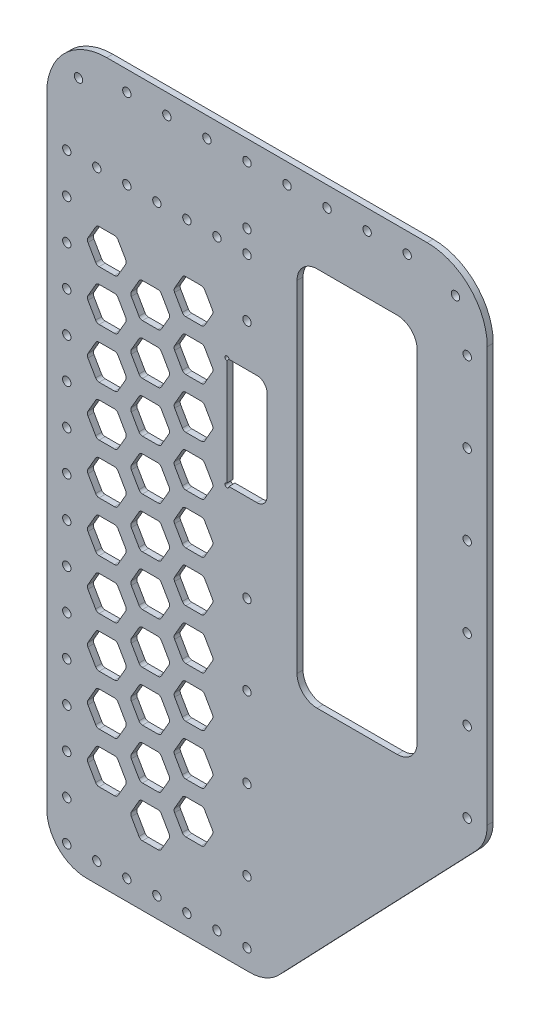
from build123d import *

# Parameters (mm, degrees)
SKETCH1_W           = 110
SKETCH1_H           = 320
BOSS_EXTRUDE1_DEPTH = 3
BOSS_EXTRUDE2_DEPTH = 3
SKETCH3_W           = 20
SKETCH3_H           = 55
SKETCH3_W_2         = 60
SKETCH3_H_2         = 190
CUT_EXTRUDE1_DEPTH  = 260.295198567
CUT_EXTRUDE2_DEPTH  = 260.295198567
FILLET1_R           = 2
FILL_PATTERN2_DEPTH = 3
SKETCH6_R           = 2.1
CUT_EXTRUDE3_DEPTH  = 260.295198567
SKETCH8_R           = 1
CUT_EXTRUDE4_DEPTH  = 260.295198567
FILLET2_R           = 5
FILLET3_R           = 10
FILLET4_R           = 20
SKETCH9_R           = 2.1
CUT_EXTRUDE5_DEPTH  = 260.295198567
SKETCH10_R          = 2.1
CUT_EXTRUDE6_DEPTH  = 260.295198567
SKETCH11_R          = 2.1
CUT_EXTRUDE7_DEPTH  = 260.295198567


# Read off the part's stored shape, not the designer's step: Fill Pattern2
with BuildPart() as part:
    # Sketch1 → Boss-Extrude1 (new body)
    with BuildSketch(Plane.XY):
        Rectangle(SKETCH1_W, SKETCH1_H)
    extrude(amount=BOSS_EXTRUDE1_DEPTH)

    # Sketch2 → Boss-Extrude2 (add)
    with BuildSketch(Plane.XY.offset(3)):
        with BuildLine():
            Line((-55, 160), (-55, 170))
            ThreePointArc((-55, 170), (-46.213203436, 191.213203436), (-25, 200))
            Line((-25, 200), (135, 200))
            ThreePointArc((135, 200), (156.213203436, 191.213203436), (165, 170))
            Line((165, 170), (165, -45))
            Line((165, -45), (55, -160))
            Line((55, -160), (55, 160))
            Line((55, 160), (-55, 160))
        make_face()
    extrude(amount=-BOSS_EXTRUDE2_DEPTH)

    # Sketch3 → Cut-Extrude1 (cut, through all)
    with BuildSketch(Plane.XY.offset(3)):
        with Locations((45, 72.508427125)):
            Rectangle(SKETCH3_W, SKETCH3_H)
        with Locations((100, 66.131519895)):
            Rectangle(SKETCH3_W_2, SKETCH3_H_2)
    extrude(amount=-CUT_EXTRUDE1_DEPTH, mode=Mode.SUBTRACT)

    # Sketch5 → Cut-Extrude2 (cut, through all)
    with BuildSketch(Plane.XY.offset(3)):
        Polygon((-20, 125), (-30, 125), (-35, 116.339745962), (-30, 107.679491924), (-20, 107.679491924), (-15, 116.339745962), align=None)
    extrude(amount=-CUT_EXTRUDE2_DEPTH, mode=Mode.SUBTRACT)

    # Fillet1
    fillet1_edges = [part.edges().sort_by_distance(p)[0] for p in [
        (-20, 125, 1.5),
        (-15, 116.339745962, 1.5),
        (-20, 107.679491924, 1.5),
        (-30, 107.679491924, 1.5),
        (-35, 116.339745962, 1.5),
        (-30, 125, 1.5),
    ]]
    fillet(fillet1_edges, radius=FILLET1_R)

    # Fill Pattern2 outline → Fill Pattern2 (cut)
    with BuildSketch(Plane.XY):
        with BuildLine():
            ThreePointArc((6.073284825, 77.839745962), (6.341234018, 78.839745962), (6.073284825, 79.839745962))
            Line((6.073284825, 79.839745962), (2.227985364, 86.5))
            ThreePointArc((2.227985364, 86.5), (1.495934556, 87.232050808), (0.495934556, 87.5))
            Line((0.495934556, 87.5), (-7.194664367, 87.5))
            ThreePointArc((-7.194664367, 87.5), (-8.194664367, 87.232050808), (-8.926715175, 86.5))
            Line((-8.926715175, 86.5), (-12.772014636, 79.839745962))
            ThreePointArc((-12.772014636, 79.839745962), (-13.039963829, 78.839745962), (-12.772014636, 77.839745962))
            Line((-12.772014636, 77.839745962), (-8.926715175, 71.179491924))
            ThreePointArc((-8.926715175, 71.179491924), (-8.194664367, 70.447441117), (-7.194664367, 70.179491924))
            Line((-7.194664367, 70.179491924), (0.495934556, 70.179491924))
            ThreePointArc((0.495934556, 70.179491924), (1.495934556, 70.447441117), (2.227985364, 71.179491924))
            Line((2.227985364, 71.179491924), (6.073284825, 77.839745962))
        make_face()
        with BuildLine():
            ThreePointArc((27.72391992, 40.339745962), (27.991869112, 41.339745962), (27.72391992, 42.339745962))
            Line((27.72391992, 42.339745962), (23.878620458, 49))
            ThreePointArc((23.878620458, 49), (23.146569651, 49.732050808), (22.146569651, 50))
            Line((22.146569651, 50), (14.455970728, 50))
            ThreePointArc((14.455970728, 50), (13.455970728, 49.732050808), (12.72391992, 49))
            Line((12.72391992, 49), (8.878620458, 42.339745962))
            ThreePointArc((8.878620458, 42.339745962), (8.610671266, 41.339745962), (8.878620458, 40.339745962))
            Line((8.878620458, 40.339745962), (12.72391992, 33.679491924))
            ThreePointArc((12.72391992, 33.679491924), (13.455970728, 32.947441117), (14.455970728, 32.679491924))
            Line((14.455970728, 32.679491924), (22.146569651, 32.679491924))
            ThreePointArc((22.146569651, 32.679491924), (23.146569651, 32.947441117), (23.878620458, 33.679491924))
            Line((23.878620458, 33.679491924), (27.72391992, 40.339745962))
        make_face()
        with BuildLine():
            ThreePointArc((12.72391992, 108.679491924), (13.455970728, 107.947441117), (14.455970728, 107.679491924))
            Line((14.455970728, 107.679491924), (22.146569651, 107.679491924))
            ThreePointArc((22.146569651, 107.679491924), (23.146569651, 107.947441117), (23.878620458, 108.679491924))
            Line((23.878620458, 108.679491924), (27.72391992, 115.339745962))
            ThreePointArc((27.72391992, 115.339745962), (27.991869112, 116.339745962), (27.72391992, 117.339745962))
            Line((27.72391992, 117.339745962), (23.878620458, 124))
            ThreePointArc((23.878620458, 124), (23.146569651, 124.732050808), (22.146569651, 125))
            Line((22.146569651, 125), (14.455970728, 125))
            ThreePointArc((14.455970728, 125), (13.455970728, 124.732050808), (12.72391992, 124))
            Line((12.72391992, 124), (8.878620458, 117.339745962))
            ThreePointArc((8.878620458, 117.339745962), (8.610671266, 116.339745962), (8.878620458, 115.339745962))
            Line((8.878620458, 115.339745962), (12.72391992, 108.679491924))
        make_face()
        with BuildLine():
            ThreePointArc((-21.154700538, 32.679491924), (-20.154700538, 32.947441117), (-19.422649731, 33.679491924))
            Line((-19.422649731, 33.679491924), (-15.577350269, 40.339745962))
            ThreePointArc((-15.577350269, 40.339745962), (-15.309401077, 41.339745962), (-15.577350269, 42.339745962))
            Line((-15.577350269, 42.339745962), (-19.422649731, 49))
            ThreePointArc((-19.422649731, 49), (-20.154700538, 49.732050808), (-21.154700538, 50))
            Line((-21.154700538, 50), (-28.845299462, 50))
            ThreePointArc((-28.845299462, 50), (-29.845299462, 49.732050808), (-30.577350269, 49))
            Line((-30.577350269, 49), (-34.422649731, 42.339745962))
            ThreePointArc((-34.422649731, 42.339745962), (-34.690598923, 41.339745962), (-34.422649731, 40.339745962))
            Line((-34.422649731, 40.339745962), (-30.577350269, 33.679491924))
            ThreePointArc((-30.577350269, 33.679491924), (-29.845299462, 32.947441117), (-28.845299462, 32.679491924))
            Line((-28.845299462, 32.679491924), (-21.154700538, 32.679491924))
        make_face()
        with BuildLine():
            ThreePointArc((27.72391992, -59.660254038), (27.991869112, -58.660254038), (27.72391992, -57.660254038))
            Line((27.72391992, -57.660254038), (23.878620458, -51))
            ThreePointArc((23.878620458, -51), (23.146569651, -50.267949192), (22.146569651, -50))
            Line((22.146569651, -50), (14.455970728, -50))
            ThreePointArc((14.455970728, -50), (13.455970728, -50.267949192), (12.72391992, -51))
            Line((12.72391992, -51), (8.878620458, -57.660254038))
            ThreePointArc((8.878620458, -57.660254038), (8.610671266, -58.660254038), (8.878620458, -59.660254038))
            Line((8.878620458, -59.660254038), (12.72391992, -66.320508076))
            ThreePointArc((12.72391992, -66.320508076), (13.455970728, -67.052558883), (14.455970728, -67.320508076))
            Line((14.455970728, -67.320508076), (22.146569651, -67.320508076))
            ThreePointArc((22.146569651, -67.320508076), (23.146569651, -67.052558883), (23.878620458, -66.320508076))
            Line((23.878620458, -66.320508076), (27.72391992, -59.660254038))
        make_face()
        with BuildLine():
            ThreePointArc((6.073284825, -22.160254038), (6.341234018, -21.160254038), (6.073284825, -20.160254038))
            Line((6.073284825, -20.160254038), (2.227985364, -13.5))
            ThreePointArc((2.227985364, -13.5), (1.495934556, -12.767949192), (0.495934556, -12.5))
            Line((0.495934556, -12.5), (-7.194664367, -12.5))
            ThreePointArc((-7.194664367, -12.5), (-8.194664367, -12.767949192), (-8.926715175, -13.5))
            Line((-8.926715175, -13.5), (-12.772014636, -20.160254038))
            ThreePointArc((-12.772014636, -20.160254038), (-13.039963829, -21.160254038), (-12.772014636, -22.160254038))
            Line((-12.772014636, -22.160254038), (-8.926715175, -28.820508076))
            ThreePointArc((-8.926715175, -28.820508076), (-8.194664367, -29.552558883), (-7.194664367, -29.820508076))
            Line((-7.194664367, -29.820508076), (0.495934556, -29.820508076))
            ThreePointArc((0.495934556, -29.820508076), (1.495934556, -29.552558883), (2.227985364, -28.820508076))
            Line((2.227985364, -28.820508076), (6.073284825, -22.160254038))
        make_face()
        with BuildLine():
            ThreePointArc((-15.577350269, 15.339745962), (-15.309401077, 16.339745962), (-15.577350269, 17.339745962))
            Line((-15.577350269, 17.339745962), (-19.422649731, 24))
            ThreePointArc((-19.422649731, 24), (-20.154700538, 24.732050808), (-21.154700538, 25))
            Line((-21.154700538, 25), (-28.845299462, 25))
            ThreePointArc((-28.845299462, 25), (-29.845299462, 24.732050808), (-30.577350269, 24))
            Line((-30.577350269, 24), (-34.422649731, 17.339745962))
            ThreePointArc((-34.422649731, 17.339745962), (-34.690598923, 16.339745962), (-34.422649731, 15.339745962))
            Line((-34.422649731, 15.339745962), (-30.577350269, 8.679491924))
            ThreePointArc((-30.577350269, 8.679491924), (-29.845299462, 7.947441117), (-28.845299462, 7.679491924))
            Line((-28.845299462, 7.679491924), (-21.154700538, 7.679491924))
            ThreePointArc((-21.154700538, 7.679491924), (-20.154700538, 7.947441117), (-19.422649731, 8.679491924))
            Line((-19.422649731, 8.679491924), (-15.577350269, 15.339745962))
        make_face()
        with BuildLine():
            ThreePointArc((0.495934556, -104.820508076), (1.495934556, -104.552558883), (2.227985364, -103.820508076))
            Line((2.227985364, -103.820508076), (6.073284825, -97.160254038))
            ThreePointArc((6.073284825, -97.160254038), (6.341234018, -96.160254038), (6.073284825, -95.160254038))
            Line((6.073284825, -95.160254038), (2.227985364, -88.5))
            ThreePointArc((2.227985364, -88.5), (1.495934556, -87.767949192), (0.495934556, -87.5))
            Line((0.495934556, -87.5), (-7.194664367, -87.5))
            ThreePointArc((-7.194664367, -87.5), (-8.194664367, -87.767949192), (-8.926715175, -88.5))
            Line((-8.926715175, -88.5), (-12.772014636, -95.160254038))
            ThreePointArc((-12.772014636, -95.160254038), (-13.039963829, -96.160254038), (-12.772014636, -97.160254038))
            Line((-12.772014636, -97.160254038), (-8.926715175, -103.820508076))
            ThreePointArc((-8.926715175, -103.820508076), (-8.194664367, -104.552558883), (-7.194664367, -104.820508076))
            Line((-7.194664367, -104.820508076), (0.495934556, -104.820508076))
        make_face()
        with BuildLine():
            ThreePointArc((-30.577350269, -66.320508076), (-29.845299462, -67.052558883), (-28.845299462, -67.320508076))
            Line((-28.845299462, -67.320508076), (-21.154700538, -67.320508076))
            ThreePointArc((-21.154700538, -67.320508076), (-20.154700538, -67.052558883), (-19.422649731, -66.320508076))
            Line((-19.422649731, -66.320508076), (-15.577350269, -59.660254038))
            ThreePointArc((-15.577350269, -59.660254038), (-15.309401077, -58.660254038), (-15.577350269, -57.660254038))
            Line((-15.577350269, -57.660254038), (-19.422649731, -51))
            ThreePointArc((-19.422649731, -51), (-20.154700538, -50.267949192), (-21.154700538, -50))
            Line((-21.154700538, -50), (-28.845299462, -50))
            ThreePointArc((-28.845299462, -50), (-29.845299462, -50.267949192), (-30.577350269, -51))
            Line((-30.577350269, -51), (-34.422649731, -57.660254038))
            ThreePointArc((-34.422649731, -57.660254038), (-34.690598923, -58.660254038), (-34.422649731, -59.660254038))
            Line((-34.422649731, -59.660254038), (-30.577350269, -66.320508076))
        make_face()
        with BuildLine():
            ThreePointArc((6.073284825, -72.160254038), (6.341234018, -71.160254038), (6.073284825, -70.160254038))
            Line((6.073284825, -70.160254038), (2.227985364, -63.5))
            ThreePointArc((2.227985364, -63.5), (1.495934556, -62.767949192), (0.495934556, -62.5))
            Line((0.495934556, -62.5), (-7.194664367, -62.5))
            ThreePointArc((-7.194664367, -62.5), (-8.194664367, -62.767949192), (-8.926715175, -63.5))
            Line((-8.926715175, -63.5), (-12.772014636, -70.160254038))
            ThreePointArc((-12.772014636, -70.160254038), (-13.039963829, -71.160254038), (-12.772014636, -72.160254038))
            Line((-12.772014636, -72.160254038), (-8.926715175, -78.820508076))
            ThreePointArc((-8.926715175, -78.820508076), (-8.194664367, -79.552558883), (-7.194664367, -79.820508076))
            Line((-7.194664367, -79.820508076), (0.495934556, -79.820508076))
            ThreePointArc((0.495934556, -79.820508076), (1.495934556, -79.552558883), (2.227985364, -78.820508076))
            Line((2.227985364, -78.820508076), (6.073284825, -72.160254038))
        make_face()
        with BuildLine():
            ThreePointArc((-15.577350269, -34.660254038), (-15.309401077, -33.660254038), (-15.577350269, -32.660254038))
            Line((-15.577350269, -32.660254038), (-19.422649731, -26))
            ThreePointArc((-19.422649731, -26), (-20.154700538, -25.267949192), (-21.154700538, -25))
            Line((-21.154700538, -25), (-28.845299462, -25))
            ThreePointArc((-28.845299462, -25), (-29.845299462, -25.267949192), (-30.577350269, -26))
            Line((-30.577350269, -26), (-34.422649731, -32.660254038))
            ThreePointArc((-34.422649731, -32.660254038), (-34.690598923, -33.660254038), (-34.422649731, -34.660254038))
            Line((-34.422649731, -34.660254038), (-30.577350269, -41.320508076))
            ThreePointArc((-30.577350269, -41.320508076), (-29.845299462, -42.052558883), (-28.845299462, -42.320508076))
            Line((-28.845299462, -42.320508076), (-21.154700538, -42.320508076))
            ThreePointArc((-21.154700538, -42.320508076), (-20.154700538, -42.052558883), (-19.422649731, -41.320508076))
            Line((-19.422649731, -41.320508076), (-15.577350269, -34.660254038))
        make_face()
        with BuildLine():
            ThreePointArc((27.72391992, -109.660254038), (27.991869112, -108.660254038), (27.72391992, -107.660254038))
            Line((27.72391992, -107.660254038), (23.878620458, -101))
            ThreePointArc((23.878620458, -101), (23.146569651, -100.267949192), (22.146569651, -100))
            Line((22.146569651, -100), (14.455970728, -100))
            ThreePointArc((14.455970728, -100), (13.455970728, -100.267949192), (12.72391992, -101))
            Line((12.72391992, -101), (8.878620458, -107.660254038))
            ThreePointArc((8.878620458, -107.660254038), (8.610671266, -108.660254038), (8.878620458, -109.660254038))
            Line((8.878620458, -109.660254038), (12.72391992, -116.320508076))
            ThreePointArc((12.72391992, -116.320508076), (13.455970728, -117.052558883), (14.455970728, -117.320508076))
            Line((14.455970728, -117.320508076), (22.146569651, -117.320508076))
            ThreePointArc((22.146569651, -117.320508076), (23.146569651, -117.052558883), (23.878620458, -116.320508076))
            Line((23.878620458, -116.320508076), (27.72391992, -109.660254038))
        make_face()
        with BuildLine():
            ThreePointArc((22.146569651, -42.320508076), (23.146569651, -42.052558883), (23.878620458, -41.320508076))
            Line((23.878620458, -41.320508076), (27.72391992, -34.660254038))
            ThreePointArc((27.72391992, -34.660254038), (27.991869112, -33.660254038), (27.72391992, -32.660254038))
            Line((27.72391992, -32.660254038), (23.878620458, -26))
            ThreePointArc((23.878620458, -26), (23.146569651, -25.267949192), (22.146569651, -25))
            Line((22.146569651, -25), (14.455970728, -25))
            ThreePointArc((14.455970728, -25), (13.455970728, -25.267949192), (12.72391992, -26))
            Line((12.72391992, -26), (8.878620458, -32.660254038))
            ThreePointArc((8.878620458, -32.660254038), (8.610671266, -33.660254038), (8.878620458, -34.660254038))
            Line((8.878620458, -34.660254038), (12.72391992, -41.320508076))
            ThreePointArc((12.72391992, -41.320508076), (13.455970728, -42.052558883), (14.455970728, -42.320508076))
            Line((14.455970728, -42.320508076), (22.146569651, -42.320508076))
        make_face()
        with BuildLine():
            ThreePointArc((-21.154700538, -117.320508076), (-20.154700538, -117.052558883), (-19.422649731, -116.320508076))
            Line((-19.422649731, -116.320508076), (-15.577350269, -109.660254038))
            ThreePointArc((-15.577350269, -109.660254038), (-15.309401077, -108.660254038), (-15.577350269, -107.660254038))
            Line((-15.577350269, -107.660254038), (-19.422649731, -101))
            ThreePointArc((-19.422649731, -101), (-20.154700538, -100.267949192), (-21.154700538, -100))
            Line((-21.154700538, -100), (-28.845299462, -100))
            ThreePointArc((-28.845299462, -100), (-29.845299462, -100.267949192), (-30.577350269, -101))
            Line((-30.577350269, -101), (-34.422649731, -107.660254038))
            ThreePointArc((-34.422649731, -107.660254038), (-34.690598923, -108.660254038), (-34.422649731, -109.660254038))
            Line((-34.422649731, -109.660254038), (-30.577350269, -116.320508076))
            ThreePointArc((-30.577350269, -116.320508076), (-29.845299462, -117.052558883), (-28.845299462, -117.320508076))
            Line((-28.845299462, -117.320508076), (-21.154700538, -117.320508076))
        make_face()
        with BuildLine():
            ThreePointArc((-15.577350269, -84.660254038), (-15.309401077, -83.660254038), (-15.577350269, -82.660254038))
            Line((-15.577350269, -82.660254038), (-19.422649731, -76))
            ThreePointArc((-19.422649731, -76), (-20.154700538, -75.267949192), (-21.154700538, -75))
            Line((-21.154700538, -75), (-28.845299462, -75))
            ThreePointArc((-28.845299462, -75), (-29.845299462, -75.267949192), (-30.577350269, -76))
            Line((-30.577350269, -76), (-34.422649731, -82.660254038))
            ThreePointArc((-34.422649731, -82.660254038), (-34.690598923, -83.660254038), (-34.422649731, -84.660254038))
            Line((-34.422649731, -84.660254038), (-30.577350269, -91.320508076))
            ThreePointArc((-30.577350269, -91.320508076), (-29.845299462, -92.052558883), (-28.845299462, -92.320508076))
            Line((-28.845299462, -92.320508076), (-21.154700538, -92.320508076))
            ThreePointArc((-21.154700538, -92.320508076), (-20.154700538, -92.052558883), (-19.422649731, -91.320508076))
            Line((-19.422649731, -91.320508076), (-15.577350269, -84.660254038))
        make_face()
        with BuildLine():
            ThreePointArc((6.073284825, -122.160254038), (6.341234018, -121.160254038), (6.073284825, -120.160254038))
            Line((6.073284825, -120.160254038), (2.227985364, -113.5))
            ThreePointArc((2.227985364, -113.5), (1.495934556, -112.767949192), (0.495934556, -112.5))
            Line((0.495934556, -112.5), (-7.194664367, -112.5))
            ThreePointArc((-7.194664367, -112.5), (-8.194664367, -112.767949192), (-8.926715175, -113.5))
            Line((-8.926715175, -113.5), (-12.772014636, -120.160254038))
            ThreePointArc((-12.772014636, -120.160254038), (-13.039963829, -121.160254038), (-12.772014636, -122.160254038))
            Line((-12.772014636, -122.160254038), (-8.926715175, -128.820508076))
            ThreePointArc((-8.926715175, -128.820508076), (-8.194664367, -129.552558883), (-7.194664367, -129.820508076))
            Line((-7.194664367, -129.820508076), (0.495934556, -129.820508076))
            ThreePointArc((0.495934556, -129.820508076), (1.495934556, -129.552558883), (2.227985364, -128.820508076))
            Line((2.227985364, -128.820508076), (6.073284825, -122.160254038))
        make_face()
        with BuildLine():
            ThreePointArc((0.495934556, -54.820508076), (1.495934556, -54.552558883), (2.227985364, -53.820508076))
            Line((2.227985364, -53.820508076), (6.073284825, -47.160254038))
            ThreePointArc((6.073284825, -47.160254038), (6.341234018, -46.160254038), (6.073284825, -45.160254038))
            Line((6.073284825, -45.160254038), (2.227985364, -38.5))
            ThreePointArc((2.227985364, -38.5), (1.495934556, -37.767949192), (0.495934556, -37.5))
            Line((0.495934556, -37.5), (-7.194664367, -37.5))
            ThreePointArc((-7.194664367, -37.5), (-8.194664367, -37.767949192), (-8.926715175, -38.5))
            Line((-8.926715175, -38.5), (-12.772014636, -45.160254038))
            ThreePointArc((-12.772014636, -45.160254038), (-13.039963829, -46.160254038), (-12.772014636, -47.160254038))
            Line((-12.772014636, -47.160254038), (-8.926715175, -53.820508076))
            ThreePointArc((-8.926715175, -53.820508076), (-8.194664367, -54.552558883), (-7.194664367, -54.820508076))
            Line((-7.194664367, -54.820508076), (0.495934556, -54.820508076))
        make_face()
        with BuildLine():
            ThreePointArc((22.146569651, -17.320508076), (23.146569651, -17.052558883), (23.878620458, -16.320508076))
            Line((23.878620458, -16.320508076), (27.72391992, -9.660254038))
            ThreePointArc((27.72391992, -9.660254038), (27.991869112, -8.660254038), (27.72391992, -7.660254038))
            Line((27.72391992, -7.660254038), (23.878620458, -1))
            ThreePointArc((23.878620458, -1), (23.146569651, -0.267949192), (22.146569651, 0))
            Line((22.146569651, 0), (14.455970728, 0))
            ThreePointArc((14.455970728, 0), (13.455970728, -0.267949192), (12.72391992, -1))
            Line((12.72391992, -1), (8.878620458, -7.660254038))
            ThreePointArc((8.878620458, -7.660254038), (8.610671266, -8.660254038), (8.878620458, -9.660254038))
            Line((8.878620458, -9.660254038), (12.72391992, -16.320508076))
            ThreePointArc((12.72391992, -16.320508076), (13.455970728, -17.052558883), (14.455970728, -17.320508076))
            Line((14.455970728, -17.320508076), (22.146569651, -17.320508076))
        make_face()
        with BuildLine():
            ThreePointArc((12.72391992, -91.320508076), (13.455970728, -92.052558883), (14.455970728, -92.320508076))
            Line((14.455970728, -92.320508076), (22.146569651, -92.320508076))
            ThreePointArc((22.146569651, -92.320508076), (23.146569651, -92.052558883), (23.878620458, -91.320508076))
            Line((23.878620458, -91.320508076), (27.72391992, -84.660254038))
            ThreePointArc((27.72391992, -84.660254038), (27.991869112, -83.660254038), (27.72391992, -82.660254038))
            Line((27.72391992, -82.660254038), (23.878620458, -76))
            ThreePointArc((23.878620458, -76), (23.146569651, -75.267949192), (22.146569651, -75))
            Line((22.146569651, -75), (14.455970728, -75))
            ThreePointArc((14.455970728, -75), (13.455970728, -75.267949192), (12.72391992, -76))
            Line((12.72391992, -76), (8.878620458, -82.660254038))
            ThreePointArc((8.878620458, -82.660254038), (8.610671266, -83.660254038), (8.878620458, -84.660254038))
            Line((8.878620458, -84.660254038), (12.72391992, -91.320508076))
        make_face()
        with BuildLine():
            ThreePointArc((-15.577350269, -9.660254038), (-15.309401077, -8.660254038), (-15.577350269, -7.660254038))
            Line((-15.577350269, -7.660254038), (-19.422649731, -1))
            ThreePointArc((-19.422649731, -1), (-20.154700538, -0.267949192), (-21.154700538, 0))
            Line((-21.154700538, 0), (-28.845299462, 0))
            ThreePointArc((-28.845299462, 0), (-29.845299462, -0.267949192), (-30.577350269, -1))
            Line((-30.577350269, -1), (-34.422649731, -7.660254038))
            ThreePointArc((-34.422649731, -7.660254038), (-34.690598923, -8.660254038), (-34.422649731, -9.660254038))
            Line((-34.422649731, -9.660254038), (-30.577350269, -16.320508076))
            ThreePointArc((-30.577350269, -16.320508076), (-29.845299462, -17.052558883), (-28.845299462, -17.320508076))
            Line((-28.845299462, -17.320508076), (-21.154700538, -17.320508076))
            ThreePointArc((-21.154700538, -17.320508076), (-20.154700538, -17.052558883), (-19.422649731, -16.320508076))
            Line((-19.422649731, -16.320508076), (-15.577350269, -9.660254038))
        make_face()
        with BuildLine():
            ThreePointArc((0.495934556, -4.820508076), (1.495934556, -4.552558883), (2.227985364, -3.820508076))
            Line((2.227985364, -3.820508076), (6.073284825, 2.839745962))
            ThreePointArc((6.073284825, 2.839745962), (6.341234018, 3.839745962), (6.073284825, 4.839745962))
            Line((6.073284825, 4.839745962), (2.227985364, 11.5))
            ThreePointArc((2.227985364, 11.5), (1.495934556, 12.232050808), (0.495934556, 12.5))
            Line((0.495934556, 12.5), (-7.194664367, 12.5))
            ThreePointArc((-7.194664367, 12.5), (-8.194664367, 12.232050808), (-8.926715175, 11.5))
            Line((-8.926715175, 11.5), (-12.772014636, 4.839745962))
            ThreePointArc((-12.772014636, 4.839745962), (-13.039963829, 3.839745962), (-12.772014636, 2.839745962))
            Line((-12.772014636, 2.839745962), (-8.926715175, -3.820508076))
            ThreePointArc((-8.926715175, -3.820508076), (-8.194664367, -4.552558883), (-7.194664367, -4.820508076))
            Line((-7.194664367, -4.820508076), (0.495934556, -4.820508076))
        make_face()
        with BuildLine():
            ThreePointArc((22.146569651, 7.679491924), (23.146569651, 7.947441117), (23.878620458, 8.679491924))
            Line((23.878620458, 8.679491924), (27.72391992, 15.339745962))
            ThreePointArc((27.72391992, 15.339745962), (27.991869112, 16.339745962), (27.72391992, 17.339745962))
            Line((27.72391992, 17.339745962), (23.878620458, 24))
            ThreePointArc((23.878620458, 24), (23.146569651, 24.732050808), (22.146569651, 25))
            Line((22.146569651, 25), (14.455970728, 25))
            ThreePointArc((14.455970728, 25), (13.455970728, 24.732050808), (12.72391992, 24))
            Line((12.72391992, 24), (8.878620458, 17.339745962))
            ThreePointArc((8.878620458, 17.339745962), (8.610671266, 16.339745962), (8.878620458, 15.339745962))
            Line((8.878620458, 15.339745962), (12.72391992, 8.679491924))
            ThreePointArc((12.72391992, 8.679491924), (13.455970728, 7.947441117), (14.455970728, 7.679491924))
            Line((14.455970728, 7.679491924), (22.146569651, 7.679491924))
        make_face()
        with BuildLine():
            ThreePointArc((-15.577350269, 65.339745962), (-15.309401077, 66.339745962), (-15.577350269, 67.339745962))
            Line((-15.577350269, 67.339745962), (-19.422649731, 74))
            ThreePointArc((-19.422649731, 74), (-20.154700538, 74.732050808), (-21.154700538, 75))
            Line((-21.154700538, 75), (-28.845299462, 75))
            ThreePointArc((-28.845299462, 75), (-29.845299462, 74.732050808), (-30.577350269, 74))
            Line((-30.577350269, 74), (-34.422649731, 67.339745962))
            ThreePointArc((-34.422649731, 67.339745962), (-34.690598923, 66.339745962), (-34.422649731, 65.339745962))
            Line((-34.422649731, 65.339745962), (-30.577350269, 58.679491924))
            ThreePointArc((-30.577350269, 58.679491924), (-29.845299462, 57.947441117), (-28.845299462, 57.679491924))
            Line((-28.845299462, 57.679491924), (-21.154700538, 57.679491924))
            ThreePointArc((-21.154700538, 57.679491924), (-20.154700538, 57.947441117), (-19.422649731, 58.679491924))
            Line((-19.422649731, 58.679491924), (-15.577350269, 65.339745962))
        make_face()
        with BuildLine():
            ThreePointArc((6.073284825, 27.839745962), (6.341234018, 28.839745962), (6.073284825, 29.839745962))
            Line((6.073284825, 29.839745962), (2.227985364, 36.5))
            ThreePointArc((2.227985364, 36.5), (1.495934556, 37.232050808), (0.495934556, 37.5))
            Line((0.495934556, 37.5), (-7.194664367, 37.5))
            ThreePointArc((-7.194664367, 37.5), (-8.194664367, 37.232050808), (-8.926715175, 36.5))
            Line((-8.926715175, 36.5), (-12.772014636, 29.839745962))
            ThreePointArc((-12.772014636, 29.839745962), (-13.039963829, 28.839745962), (-12.772014636, 27.839745962))
            Line((-12.772014636, 27.839745962), (-8.926715175, 21.179491924))
            ThreePointArc((-8.926715175, 21.179491924), (-8.194664367, 20.447441117), (-7.194664367, 20.179491924))
            Line((-7.194664367, 20.179491924), (0.495934556, 20.179491924))
            ThreePointArc((0.495934556, 20.179491924), (1.495934556, 20.447441117), (2.227985364, 21.179491924))
            Line((2.227985364, 21.179491924), (6.073284825, 27.839745962))
        make_face()
        with BuildLine():
            ThreePointArc((0.495934556, 95.179491924), (1.495934556, 95.447441117), (2.227985364, 96.179491924))
            Line((2.227985364, 96.179491924), (6.073284825, 102.839745962))
            ThreePointArc((6.073284825, 102.839745962), (6.341234018, 103.839745962), (6.073284825, 104.839745962))
            Line((6.073284825, 104.839745962), (2.227985364, 111.5))
            ThreePointArc((2.227985364, 111.5), (1.495934556, 112.232050808), (0.495934556, 112.5))
            Line((0.495934556, 112.5), (-7.194664367, 112.5))
            ThreePointArc((-7.194664367, 112.5), (-8.194664367, 112.232050808), (-8.926715175, 111.5))
            Line((-8.926715175, 111.5), (-12.772014636, 104.839745962))
            ThreePointArc((-12.772014636, 104.839745962), (-13.039963829, 103.839745962), (-12.772014636, 102.839745962))
            Line((-12.772014636, 102.839745962), (-8.926715175, 96.179491924))
            ThreePointArc((-8.926715175, 96.179491924), (-8.194664367, 95.447441117), (-7.194664367, 95.179491924))
            Line((-7.194664367, 95.179491924), (0.495934556, 95.179491924))
        make_face()
        with BuildLine():
            ThreePointArc((12.72391992, 58.679491924), (13.455970728, 57.947441117), (14.455970728, 57.679491924))
            Line((14.455970728, 57.679491924), (22.146569651, 57.679491924))
            ThreePointArc((22.146569651, 57.679491924), (23.146569651, 57.947441117), (23.878620458, 58.679491924))
            Line((23.878620458, 58.679491924), (27.72391992, 65.339745962))
            ThreePointArc((27.72391992, 65.339745962), (27.991869112, 66.339745962), (27.72391992, 67.339745962))
            Line((27.72391992, 67.339745962), (23.878620458, 74))
            ThreePointArc((23.878620458, 74), (23.146569651, 74.732050808), (22.146569651, 75))
            Line((22.146569651, 75), (14.455970728, 75))
            ThreePointArc((14.455970728, 75), (13.455970728, 74.732050808), (12.72391992, 74))
            Line((12.72391992, 74), (8.878620458, 67.339745962))
            ThreePointArc((8.878620458, 67.339745962), (8.610671266, 66.339745962), (8.878620458, 65.339745962))
            Line((8.878620458, 65.339745962), (12.72391992, 58.679491924))
        make_face()
        with BuildLine():
            ThreePointArc((6.073284825, 52.839745962), (6.341234018, 53.839745962), (6.073284825, 54.839745962))
            Line((6.073284825, 54.839745962), (2.227985364, 61.5))
            ThreePointArc((2.227985364, 61.5), (1.495934556, 62.232050808), (0.495934556, 62.5))
            Line((0.495934556, 62.5), (-7.194664367, 62.5))
            ThreePointArc((-7.194664367, 62.5), (-8.194664367, 62.232050808), (-8.926715175, 61.5))
            Line((-8.926715175, 61.5), (-12.772014636, 54.839745962))
            ThreePointArc((-12.772014636, 54.839745962), (-13.039963829, 53.839745962), (-12.772014636, 52.839745962))
            Line((-12.772014636, 52.839745962), (-8.926715175, 46.179491924))
            ThreePointArc((-8.926715175, 46.179491924), (-8.194664367, 45.447441117), (-7.194664367, 45.179491924))
            Line((-7.194664367, 45.179491924), (0.495934556, 45.179491924))
            ThreePointArc((0.495934556, 45.179491924), (1.495934556, 45.447441117), (2.227985364, 46.179491924))
            Line((2.227985364, 46.179491924), (6.073284825, 52.839745962))
        make_face()
        with BuildLine():
            ThreePointArc((-15.577350269, 90.339745962), (-15.309401077, 91.339745962), (-15.577350269, 92.339745962))
            Line((-15.577350269, 92.339745962), (-19.422649731, 99))
            ThreePointArc((-19.422649731, 99), (-20.154700538, 99.732050808), (-21.154700538, 100))
            Line((-21.154700538, 100), (-28.845299462, 100))
            ThreePointArc((-28.845299462, 100), (-29.845299462, 99.732050808), (-30.577350269, 99))
            Line((-30.577350269, 99), (-34.422649731, 92.339745962))
            ThreePointArc((-34.422649731, 92.339745962), (-34.690598923, 91.339745962), (-34.422649731, 90.339745962))
            Line((-34.422649731, 90.339745962), (-30.577350269, 83.679491924))
            ThreePointArc((-30.577350269, 83.679491924), (-29.845299462, 82.947441117), (-28.845299462, 82.679491924))
            Line((-28.845299462, 82.679491924), (-21.154700538, 82.679491924))
            ThreePointArc((-21.154700538, 82.679491924), (-20.154700538, 82.947441117), (-19.422649731, 83.679491924))
            Line((-19.422649731, 83.679491924), (-15.577350269, 90.339745962))
        make_face()
        with BuildLine():
            ThreePointArc((22.146569651, 82.679491924), (23.146569651, 82.947441117), (23.878620458, 83.679491924))
            Line((23.878620458, 83.679491924), (27.72391992, 90.339745962))
            ThreePointArc((27.72391992, 90.339745962), (27.991869112, 91.339745962), (27.72391992, 92.339745962))
            Line((27.72391992, 92.339745962), (23.878620458, 99))
            ThreePointArc((23.878620458, 99), (23.146569651, 99.732050808), (22.146569651, 100))
            Line((22.146569651, 100), (14.455970728, 100))
            ThreePointArc((14.455970728, 100), (13.455970728, 99.732050808), (12.72391992, 99))
            Line((12.72391992, 99), (8.878620458, 92.339745962))
            ThreePointArc((8.878620458, 92.339745962), (8.610671266, 91.339745962), (8.878620458, 90.339745962))
            Line((8.878620458, 90.339745962), (12.72391992, 83.679491924))
            ThreePointArc((12.72391992, 83.679491924), (13.455970728, 82.947441117), (14.455970728, 82.679491924))
            Line((14.455970728, 82.679491924), (22.146569651, 82.679491924))
        make_face()
    extrude(amount=FILL_PATTERN2_DEPTH, mode=Mode.SUBTRACT)

    # Sketch6 → Cut-Extrude3 (cut, through all)
    with BuildSketch(Plane(origin=(0, 0, 0), x_dir=(-1, 0, 0), z_dir=(0, 0, -1))):
        with Locations((-155, 161.131519895)):
            Circle(SKETCH6_R)
        with Locations((-45, 161.131519895)):
            Circle(SKETCH6_R)
        with Locations((-155, 121.131519895)):
            Circle(SKETCH6_R)
        with Locations((-45, 121.131519895)):
            Circle(SKETCH6_R)
        with Locations((-155, 81.131519895)):
            Circle(SKETCH6_R)
        with Locations((-155, 41.131519895)):
            Circle(SKETCH6_R)
        with Locations((-155, 1.131519895)):
            Circle(SKETCH6_R)
        with Locations((-45, 1.131519895)):
            Circle(SKETCH6_R)
        with Locations((-155, -38.868480105)):
            Circle(SKETCH6_R)
        with Locations((-45, -38.868480105)):
            Circle(SKETCH6_R)
        with Locations((-45, -78.868480105)):
            Circle(SKETCH6_R)
        with Locations((-45, -118.868480105)):
            Circle(SKETCH6_R)
    extrude(amount=-CUT_EXTRUDE3_DEPTH, mode=Mode.SUBTRACT)

    # Sketch8 → Cut-Extrude4 (cut, through all)
    with BuildSketch(Plane(origin=(0, 0, 0), x_dir=(-1, 0, 0), z_dir=(0, 0, -1))):
        with Locations((-35, 100.008427125)):
            Circle(SKETCH8_R)
        with Locations((-35, 45.008427125)):
            Circle(SKETCH8_R)
    extrude(amount=-CUT_EXTRUDE4_DEPTH, mode=Mode.SUBTRACT)

    # Fillet2
    fillet2_edges = [part.edges().sort_by_distance(p)[0] for p in [
        (55, 100.008427125, 1.5),
        (55, 45.008427125, 1.5),
    ]]
    fillet(fillet2_edges, radius=FILLET2_R)

    # Fillet3
    fillet3_edges = [part.edges().sort_by_distance(p)[0] for p in [
        (70, -28.868480105, 1.5),
        (70, 161.131519895, 1.5),
        (130, 161.131519895, 1.5),
        (130, -28.868480105, 1.5),
    ]]
    fillet(fillet3_edges, radius=FILLET3_R)

    # Fillet4
    fillet4_edges = [part.edges().sort_by_distance(p)[0] for p in [
        (165, -45, 1.5),
        (-55, -160, 1.5),
        (55, -160, 1.5),
    ]]
    fillet(fillet4_edges, radius=FILLET4_R)

    # Sketch9 → Cut-Extrude5 (cut, through all)
    with BuildSketch(Plane(origin=(0, 0, 0), x_dir=(-1, 0, 0), z_dir=(0, 0, -1))):
        with Locations((45, 150)):
            Circle(SKETCH9_R)
        with Locations((30, 150)):
            Circle(SKETCH9_R)
        with Locations((15, 150)):
            Circle(SKETCH9_R)
        with Locations((0, 150)):
            Circle(SKETCH9_R)
        with Locations((-15, 150)):
            Circle(SKETCH9_R)
        with Locations((45, -150)):
            Circle(SKETCH9_R)
        with Locations((-30, 150)):
            Circle(SKETCH9_R)
        with Locations((-45, 150)):
            Circle(SKETCH9_R)
        with Locations((30, -150)):
            Circle(SKETCH9_R)
        with Locations((15, -150)):
            Circle(SKETCH9_R)
        with Locations((0, -150)):
            Circle(SKETCH9_R)
        with Locations((-15, -150)):
            Circle(SKETCH9_R)
        with Locations((-30, -150)):
            Circle(SKETCH9_R)
        with Locations((-45, -150)):
            Circle(SKETCH9_R)
    extrude(amount=-CUT_EXTRUDE5_DEPTH, mode=Mode.SUBTRACT)

    # Sketch10 → Cut-Extrude6 (cut, through all)
    with BuildSketch(Plane(origin=(0, 0, 0), x_dir=(-1, 0, 0), z_dir=(0, 0, -1))):
        with Locations((45, -130)):
            Circle(SKETCH10_R)
        with Locations((45, -110)):
            Circle(SKETCH10_R)
        with Locations((45, -90)):
            Circle(SKETCH10_R)
        with Locations((45, -70)):
            Circle(SKETCH10_R)
        with Locations((45, -50)):
            Circle(SKETCH10_R)
        with Locations((45, -30)):
            Circle(SKETCH10_R)
        with Locations((45, -10)):
            Circle(SKETCH10_R)
        with Locations((45, 10)):
            Circle(SKETCH10_R)
        with Locations((45, 30)):
            Circle(SKETCH10_R)
        with Locations((45, 50)):
            Circle(SKETCH10_R)
        with Locations((45, 70)):
            Circle(SKETCH10_R)
        with Locations((45, 90)):
            Circle(SKETCH10_R)
        with Locations((45, 110)):
            Circle(SKETCH10_R)
        with Locations((45, 130)):
            Circle(SKETCH10_R)
    extrude(amount=-CUT_EXTRUDE6_DEPTH, mode=Mode.SUBTRACT)

    # Sketch11 → Cut-Extrude7 (cut, through all)
    with BuildSketch(Plane.XY.offset(3)):
        with Locations((-39.142135624, 184.142135624)):
            Circle(SKETCH11_R)
        with Locations((-15, 190)):
            Circle(SKETCH11_R)
        with Locations((25, 190)):
            Circle(SKETCH11_R)
        with Locations((45, 190)):
            Circle(SKETCH11_R)
        with Locations((5, 190)):
            Circle(SKETCH11_R)
        with Locations((65, 190)):
            Circle(SKETCH11_R)
        with Locations((85, 190)):
            Circle(SKETCH11_R)
        with Locations((105, 190)):
            Circle(SKETCH11_R)
        with Locations((125, 190)):
            Circle(SKETCH11_R)
        with Locations((149.142135624, 184.142135624)):
            Circle(SKETCH11_R)
        with Locations(Location((155, 161.131519895, 0), (0, 0, 180))):
            Circle(SKETCH11_R)
    extrude(amount=-CUT_EXTRUDE7_DEPTH, mode=Mode.SUBTRACT)


solid = part.part
